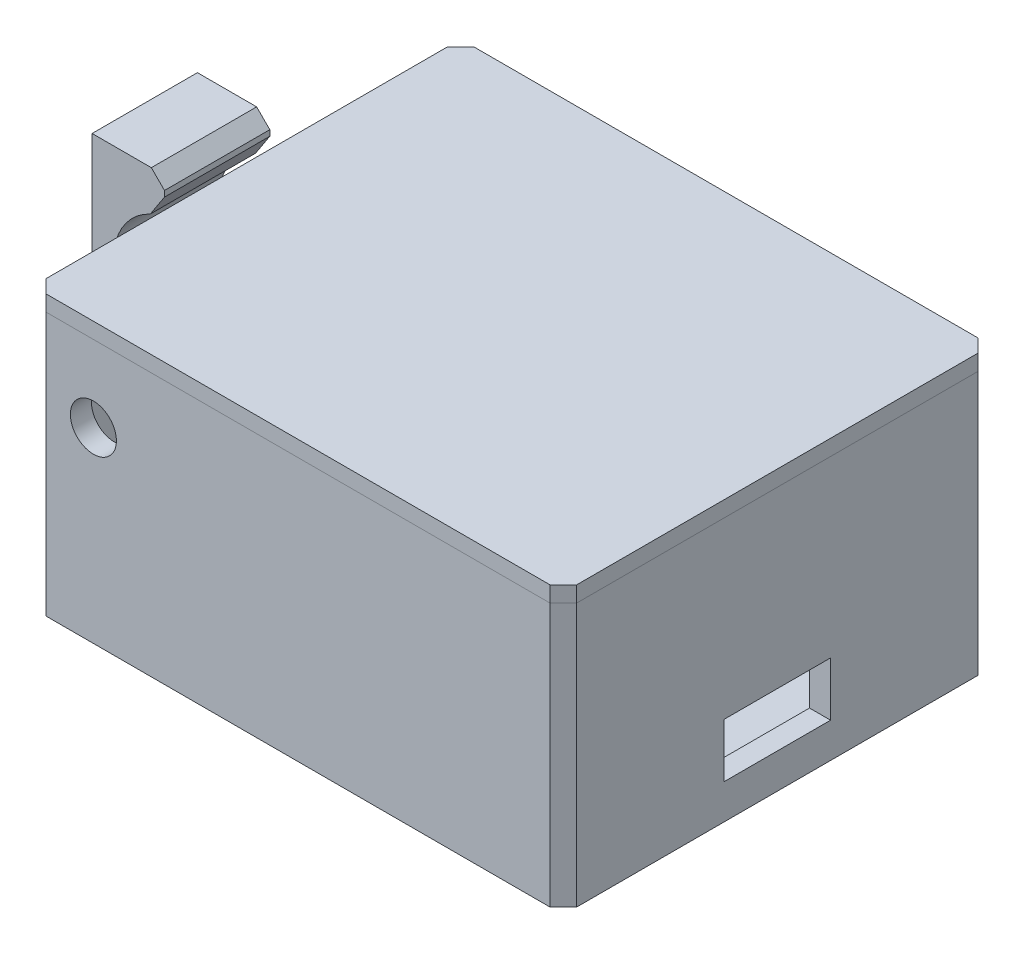
from build123d import *

# Parameters (mm, degrees)
SKETCH2_W                = 40.3
SKETCH2_H                = 32.5
BOSS_EXTRUDE1_DEPTH      = 1.2
SKETCH2_3_W              = 40.3
SKETCH2_3_H              = 32.5
SKETCH2_3_W_2            = 37.1
SKETCH2_3_H_2            = 29.3
BOSS_EXTRUDE2_DEPTH      = 20
CUT_EXTRUDE1_REACH       = 49.835
SKETCH3_W                = 8.1
SKETCH3_H                = 4.1
CHAMFER1_SIZE            = 1
SKETCH4_W                = 8
SKETCH4_H                = 15
BOSS_EXTRUDE3_DEPTH      = 15
CUT_EXTRUDE3_REACH       = 46.473
CHAMFER2_SIZE            = 1.292646163
CHAMFER2_SIZE_2          = 1
CHAMFER3_SIZE            = 1
SKETCH6_W                = 5
SKETCH6_H                = 2
CUT_EXTRUDE4_DEPTH       = 0.4
CHAMFER4_SIZE            = 0.4
CHAMFER4_OF_MIRROR1_SIZE = 0.4
BOSS_EXTRUDE4_DEPTH      = 1.2
SKETCH8_W                = 36.6
SKETCH8_H                = 28.8
SKETCH8_W_2              = 35
SKETCH8_H_2              = 27.2
BOSS_EXTRUDE5_DEPTH      = 1.2
SKETCH10_W               = 5
SKETCH10_H               = 1.2
BOSS_EXTRUDE6_DEPTH      = 3.5
BOSS_EXTRUDE7_DEPTH      = 5
MIRROR7_COPY_1_SKETCH_W  = 5
MIRROR7_COPY_1_SKETCH_H  = 1.2
MIRROR7_COPY_1_DEPTH     = 3.5
MIRROR7_COPY_2_DEPTH     = 5
SKETCH15_R               = 1.75
CUT_EXTRUDE6_DEPTH       = 1.6
CHAMFER6_SIZE2           = 3
CHAMFER6_SIZE            = 1.732050808


# Some blends are built 0.0001 mm under size
with BuildPart() as part:
    # Sketch2 → Boss-Extrude1 (new body)
    with BuildSketch(Plane(origin=(0, 0, 0), x_dir=(1, 0, 0), z_dir=(0, 1, 0))):
        Rectangle(SKETCH2_W, SKETCH2_H)
    extrude(amount=BOSS_EXTRUDE1_DEPTH)

    # Sketch2<3> → Boss-Extrude2 (add)
    with BuildSketch(Plane(origin=(0, 0, 0), x_dir=(1, 0, 0), z_dir=(0, 1, 0))):
        Rectangle(SKETCH2_3_W, SKETCH2_3_H)
        Rectangle(SKETCH2_3_W_2, SKETCH2_3_H_2, mode=Mode.SUBTRACT)
    extrude(amount=BOSS_EXTRUDE2_DEPTH)

    # Sketch3 → Cut-Extrude1 (cut, up to next)
    with BuildSketch(Plane(origin=(20.15, 0, 0), x_dir=(0, 0, -1), z_dir=(1, 0, 0)), mode=Mode.PRIVATE) as cut_extrude1_sk1:
        with Locations((0, 4.7)):
            Rectangle(SKETCH3_W, SKETCH3_H)
    cut_extrude1_tool1 = extrude(cut_extrude1_sk1.sketch, amount=-CUT_EXTRUDE1_REACH, mode=Mode.PRIVATE) & part.part
    add(cut_extrude1_tool1.solids().sort_by_distance((20.15, 4.7, 0))[0], mode=Mode.SUBTRACT)

    # Chamfer1
    chamfer1_edges = [part.edges().sort_by_distance(p)[0] for p in [
        (-20.15, 10, -16.25),
        (20.15, 10, -16.25),
        (20.15, 10, 16.25),
        (-20.15, 10, 16.25),
    ]]
    chamfer(chamfer1_edges, length=CHAMFER1_SIZE)

    # Sketch4 → Boss-Extrude3 (add)
    with BuildSketch(Plane.ZY.offset(20.15)):
        with Locations((-6.25220384, 7.5)):
            Rectangle(SKETCH4_W, SKETCH4_H)
    extrude(amount=BOSS_EXTRUDE3_DEPTH)

    # Sketch5 → Cut-Extrude3 (cut, up to next)
    with BuildSketch(Plane.XY.offset(-2.25220384), mode=Mode.PRIVATE) as cut_extrude3_sk1:
        with BuildLine():
            Line((-28.65, 12.271333671), (-28.65, 15))
            Line((-28.65, 15), (-26.65, 15))
            Line((-26.65, 15), (-26.65, 12.271333671))
            ThreePointArc((-26.65, 12.271333671), (-27.65, 2.625), (-28.65, 12.271333671))
        make_face()
    cut_extrude3_tool1 = extrude(cut_extrude3_sk1.sketch, amount=-CUT_EXTRUDE3_REACH, mode=Mode.PRIVATE) & part.part
    add(cut_extrude3_tool1.solids().sort_by_distance((-27.65, 7.91032, -2.252204))[0], mode=Mode.SUBTRACT)

    # Chamfer2
    # the kernel refuses this chamfer: 1.292646163, 1 mm, written as the material it takes off along each edge
    with BuildSketch(Plane(origin=(-28.65, 12.271333671, 1.088369735), x_dir=(-0.9479887076176806, -0.3183039588653585, 0), z_dir=(0, 0, -1))) as chamfer2_piece_1:
        with BuildLine():
            Line((1.141491378, 0), (-CHAMFER2_SIZE * 0.318303958917, CHAMFER2_SIZE * 0.947988707772))
            Line((-CHAMFER2_SIZE * 0.318303958917, CHAMFER2_SIZE * 0.947988707772), (0, 0))
            ThreePointArc((0, 0), (0.591249169, 0.033482483), (1.141491378, 0))
        make_face()
    extrude(amount=14.68114715, mode=Mode.SUBTRACT)
    with BuildSketch(Plane(origin=(-28.65, 15, 0.319479148), x_dir=(0, -1, 0), z_dir=(0, 0, -1)), Plane(origin=(-26.65, 15, 0.319479148), x_dir=(1, 0, 0), z_dir=(0, 0, -1))) as chamfer2_piece_2:
        Polygon((CHAMFER2_SIZE_2, 0), (0, CHAMFER2_SIZE_2), (0, 0), align=None)
    extrude(amount=13.143365976, mode=Mode.SUBTRACT)
    with BuildSketch(Plane(origin=(-26.65, 12.271333671, 1.088369735), x_dir=(0, 1, 0), z_dir=(0, 0, -1))) as chamfer2_piece_3:
        with BuildLine():
            Line((CHAMFER2_SIZE, 0), (-0.363341225, 1.082120936))
            ThreePointArc((-0.363341225, 1.082120936), (-0.156455935, 0.571155143), (0, 0))
            Line((0, 0), (CHAMFER2_SIZE, 0))
        make_face()
    extrude(amount=14.68114715, mode=Mode.SUBTRACT)

    # Chamfer3
    chamfer3_edges = [part.edges().sort_by_distance(p)[0] for p in [
        (-20.15, 7.5, -10.25220384),
        (-20.15, 7.5, -2.25220384),
        (-35.15, 7.5, -10.25220384),
        (-35.15, 7.5, -2.25220384),
        (-35.15, 15, -6.25220384),
    ]]
    chamfer(chamfer3_edges, length=CHAMFER3_SIZE)

    # Sketch6 → Cut-Extrude4 (cut)
    with BuildSketch(Plane(origin=(0, 0, 14.65), x_dir=(-1, 0, 0), z_dir=(0, 0, -1))):
        with Locations((-9, 17.5)):
            Rectangle(SKETCH6_W, SKETCH6_H)
        with Locations((9, 17.5)):
            Rectangle(SKETCH6_W, SKETCH6_H)
    cut_extrude4 = extrude(amount=-CUT_EXTRUDE4_DEPTH, mode=Mode.SUBTRACT)

    # Chamfer4
    chamfer4_edges = [part.edges().sort_by_distance(p)[0] for p in [
        (9, 18.5, 15.05),
        (-9, 18.5, 15.05),
    ]]
    chamfer(chamfer4_edges, length=CHAMFER4_SIZE - 0.0001)  # a hair under: the kernel refuses the full size

    # Mirror1: Cut-Extrude4 across plane
    add(cut_extrude4.mirror(Plane.XY), mode=Mode.SUBTRACT)

    # Chamfer4 of Mirror1
    chamfer4_of_mirror1_edges = [part.edges().sort_by_distance(p)[0] for p in [
        (9, 18.5, -15.05),
        (-9, 18.5, -15.05),
    ]]
    chamfer(chamfer4_of_mirror1_edges, length=CHAMFER4_OF_MIRROR1_SIZE - 0.0001)  # a hair under: the kernel refuses the full size

    # Sketch15 → Cut-Extrude6 (cut)
    with BuildSketch(Plane(origin=(0, 0, 14.65), x_dir=(-1, 0, 0), z_dir=(0, 0, -1))):
        with Locations((15.55, 14.2)):
            Circle(SKETCH15_R)
    extrude(amount=-CUT_EXTRUDE6_DEPTH, mode=Mode.SUBTRACT)

    # Chamfer6
    chamfer6_edges = [part.edges().sort_by_distance(p)[0] for p in [
        (-20.15, 15, -6.25220384),
    ]]
    chamfer6_side = [part.faces().sort_by_distance(p)[0] for p in [
        (-20.15, 15.034641016, -6.25220384),
    ]]
    chamfer(chamfer6_edges, length=CHAMFER6_SIZE - 0.0001, length2=CHAMFER6_SIZE2 - 0.0001, reference=chamfer6_side[0])  # a hair under: the kernel refuses the full size


with BuildPart() as body_2:
    # Sketch7 → Boss-Extrude4 (new body)
    with BuildSketch(Plane(origin=(0, 20, 0), x_dir=(1, 0, 0), z_dir=(0, 1, 0))):
        Polygon((-19.15, 16.25), (-20.15, 15.25), (-20.15, -15.25), (-19.15, -16.25), (19.15, -16.25), (20.15, -15.25), (20.15, 15.25), (19.15, 16.25), align=None)
    extrude(amount=BOSS_EXTRUDE4_DEPTH)

    # Sketch8 → Boss-Extrude5 (add)
    with BuildSketch(Plane.XZ.offset(-20)):
        Rectangle(SKETCH8_W, SKETCH8_H)
        Rectangle(SKETCH8_W_2, SKETCH8_H_2, mode=Mode.SUBTRACT)
    extrude(amount=BOSS_EXTRUDE5_DEPTH)

    # Sketch10 → Boss-Extrude6 (add)
    with BuildSketch(Plane.XZ.offset(-20)):
        with Locations((9, 13.8)):
            Rectangle(SKETCH10_W, SKETCH10_H)
    boss_extrude6 = extrude(amount=BOSS_EXTRUDE6_DEPTH)

    # Sketch13 → Boss-Extrude7 (add)
    with BuildSketch(Plane.ZY.offset(-6.5)):
        Polygon((15, 18.079289322), (14.4, 18.679289322), (14.4, 16.5), (15, 17.1), align=None)
    boss_extrude7 = extrude(amount=-BOSS_EXTRUDE7_DEPTH)

    # Mirror6: Boss-Extrude6, Boss-Extrude7 across plane
    add(boss_extrude6.mirror(Plane.ZY))
    add(boss_extrude7.mirror(Plane.ZY))

    # Mirror7: Boss-Extrude6, Boss-Extrude7 across plane
    add(boss_extrude6.mirror(Plane.XY))
    add(boss_extrude7.mirror(Plane.XY))

    # Mirror7 copy 1 sketch → Mirror7 copy 1 (add)
    with BuildSketch(Plane(origin=(0, 20, 0), x_dir=(-1, 0, 0), z_dir=(0, -1, 0))):
        with Locations((9, 13.8)):
            Rectangle(MIRROR7_COPY_1_SKETCH_W, MIRROR7_COPY_1_SKETCH_H)
    extrude(amount=MIRROR7_COPY_1_DEPTH)

    # Mirror7 copy 2 sketch → Mirror7 copy 2 (add)
    with BuildSketch(Plane(origin=(-6.5, 0, 0), x_dir=(0, 0, -1), z_dir=(1, 0, 0))):
        Polygon((15, 18.079289322), (14.4, 18.679289322), (14.4, 16.5), (15, 17.1), align=None)
    extrude(amount=-MIRROR7_COPY_2_DEPTH)


solid = Compound([part.part, body_2.part])
